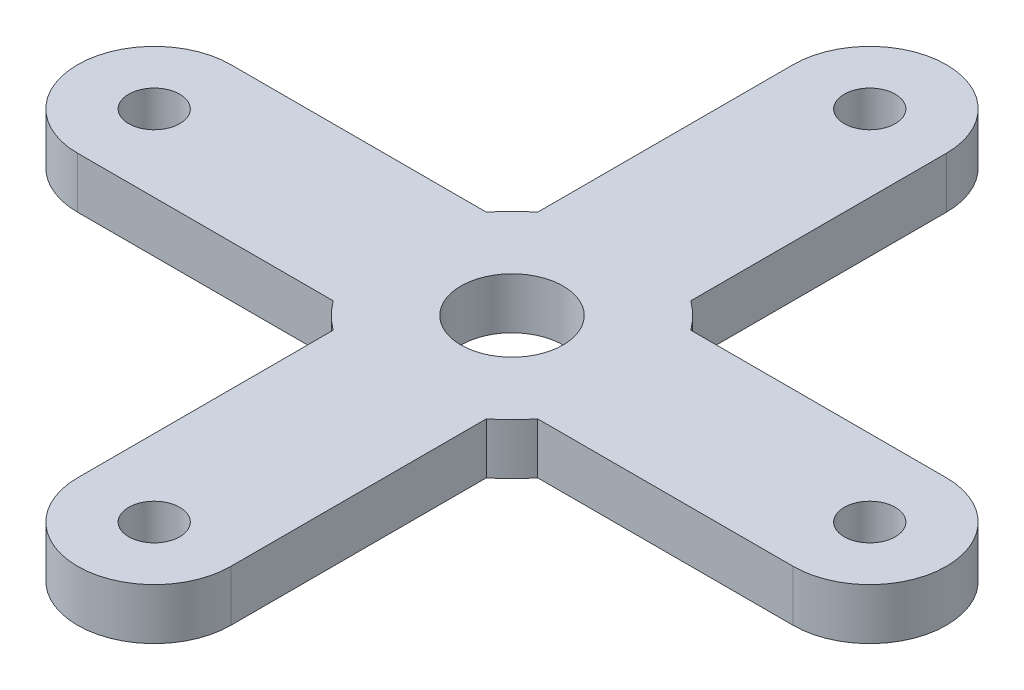
from build123d import *

# Parameters (mm, degrees)
SKETCH4_R           = 0.5
SKETCH4_R_2         = 1
BOSS_EXTRUDE1_DEPTH = 1


with BuildPart() as part:
    # Sketch4 → Boss-Extrude1 (new body)
    with BuildSketch(Plane(origin=(0, 0, 0), x_dir=(1, 0, 0), z_dir=(0, 1, 0))):
        with BuildLine():
            Line((2, -1.5), (7, -1.5))
            ThreePointArc((7, -1.5), (8.5, 0), (7, 1.5))
            Line((7, 1.5), (2, 1.5))
            ThreePointArc((2, 1.5), (1.767766953, 1.767766953), (1.5, 2))
            Line((1.5, 2), (1.5, 7))
            ThreePointArc((1.5, 7), (0, 8.5), (-1.5, 7))
            Line((-1.5, 7), (-1.5, 2))
            ThreePointArc((-1.5, 2), (-1.767766953, 1.767766953), (-2, 1.5))
            Line((-2, 1.5), (-7, 1.5))
            ThreePointArc((-7, 1.5), (-8.5, 0), (-7, -1.5))
            Line((-7, -1.5), (-2, -1.5))
            ThreePointArc((-2, -1.5), (-1.767766953, -1.767766953), (-1.5, -2))
            Line((-1.5, -2), (-1.5, -7))
            ThreePointArc((-1.5, -7), (0, -8.5), (1.5, -7))
            Line((1.5, -7), (1.5, -2))
            ThreePointArc((1.5, -2), (1.767766953, -1.767766953), (2, -1.5))
        make_face()
        with Locations((7, 0)):
            Circle(SKETCH4_R, mode=Mode.SUBTRACT)
        Circle(SKETCH4_R_2, mode=Mode.SUBTRACT)
        with Locations((0, -7)):
            Circle(SKETCH4_R, mode=Mode.SUBTRACT)
        with Locations((-7, 0)):
            Circle(SKETCH4_R, mode=Mode.SUBTRACT)
        with Locations((0, 7)):
            Circle(SKETCH4_R, mode=Mode.SUBTRACT)
    extrude(amount=BOSS_EXTRUDE1_DEPTH)


solid = part.part
